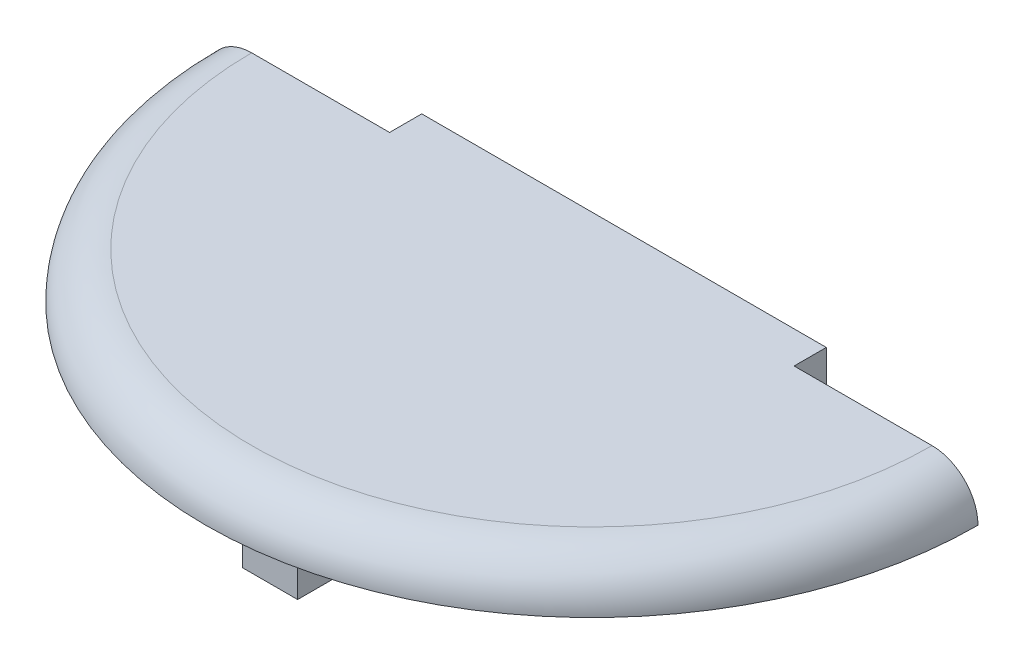
from build123d import *

# Parameters (mm, degrees)
CUT_EXTRUDE1_DEPTH       = 5
CUT_EXTRUDE3_DEPTH       = 45
SKETCH8_R                = 40
CUT_EXTRUDE4_DEPTH       = 32
SKETCH9_R                = 32
SKETCH9_R_2              = 24.5
CUT_EXTRUDE5_DEPTH       = 14
SKETCH10_R               = 26
CUT_EXTRUDE6_DEPTH       = 14
FILLET1_R                = 7
FILLET2_R                = 7
CUT_REVOLVE1_START       = 22
CUT_REVOLVE1_DEPTH       = 30.5
CUT_EXTRUDE12_DEPTH      = 5
SKETCH18_W               = 13
SKETCH18_H               = 8
CUT_EXTRUDE13_DEPTH      = 5
INTERSECT1_OUTLINE_R     = 42
INTERSECT1_DEPTH         = 55
SKETCH20_W               = 6
SKETCH20_H               = 3
BOSS_EXTRUDE1_DEPTH      = 8
BOSS_EXTRUDE2_DEPTH      = 1
BOSS_EXTRUDE2_DEPTH_BACK = 1
SKETCH21_W               = 6
SKETCH21_H               = 6
BOSS_EXTRUDE3_DEPTH      = 7
SKETCH19_R               = 1.5
CUT_EXTRUDE14_DEPTH      = 8
SKETCH23_W               = 20
SKETCH23_H               = 7
CUT_EXTRUDE15_DEPTH      = 7
SKETCH24_W               = 44
SKETCH24_H               = 3.5
CUT_EXTRUDE16_DEPTH      = 5


# Read off the part's stored shape, not the designer's step: Cut-Revolve1, Intersect1
with BuildPart() as part:
    # Sketch1 → Revolve1 (revolve)
    with BuildSketch(Plane.XY, mode=Mode.PRIVATE) as revolve1_sk:
        with BuildLine():
            Line((22.5, 0), (32, 0))
            ThreePointArc((32, 0), (33.414213562, 0.585786438), (34, 2))
            Line((34, 2), (34, 18))
            Line((34, 18), (40, 18))
            ThreePointArc((40, 18), (41.414213562, 18.585786438), (42, 20))
            Line((42, 20), (42, 55))
            ThreePointArc((42, 55), (40.535533906, 58.535533906), (37, 60))
            Line((37, 60), (0, 60))
            Line((0, 60), (0, 18))
            Line((0, 18), (22.5, 18))
            Line((22.5, 18), (22.5, 0))
        make_face()
    revolve(revolve1_sk.sketch.rotate(Axis((0, 2, 0), (0, 1, 0)), 90), axis=Axis((0, 2, 0), (0, 1, 0)))

    # Sketch5 → Cut-Extrude1 (cut)
    with BuildSketch(Plane(origin=(0, 60, 0), x_dir=(1, 0, 0), z_dir=(0, 1, 0))):
        with BuildLine():
            Line((-42, 0), (-40, 0))
            Line((-40, 0), (40, 0))
            Line((40, 0), (42, 0))
            ThreePointArc((42, 0), (0, 42), (-42, 0))
        make_face()
    extrude(amount=-CUT_EXTRUDE1_DEPTH, mode=Mode.SUBTRACT)

    # Sketch7 → Cut-Extrude3 (cut)
    with BuildSketch(Plane.XZ.offset(-18)):
        with BuildLine():
            Line((-21, 0), (21, 0))
            ThreePointArc((21, 0), (0, -21), (-21, 0))
        make_face()
    extrude(amount=-CUT_EXTRUDE3_DEPTH, mode=Mode.SUBTRACT)

    # Sketch8 → Cut-Extrude4 (cut)
    with BuildSketch(Plane(origin=(0, 52.5, 0), x_dir=(1, 0, 0), z_dir=(0, 1, 0))):
        with Locations(Location((0, 0, 0), (0, 0, 270))):
            Circle(SKETCH8_R)
        with BuildLine():
            Line((22.912878475, -2), (-22.912878475, -2))
            ThreePointArc((-22.912878475, -2), (0, 23), (22.912878475, -2))
        make_face(mode=Mode.SUBTRACT)
    extrude(amount=-CUT_EXTRUDE4_DEPTH, mode=Mode.SUBTRACT)

    # Sketch9 → Cut-Extrude5 (cut)
    with BuildSketch(Plane(origin=(0, 2, 0), x_dir=(-1, 0, 0), z_dir=(0, -1, 0))):
        with Locations(Location((0, 0, 0), (0, 0, 90))):
            Circle(SKETCH9_R)
        with Locations(Location((0, 0, 0), (0, 0, 90))):
            Circle(SKETCH9_R_2, mode=Mode.SUBTRACT)
    extrude(amount=-CUT_EXTRUDE5_DEPTH, mode=Mode.SUBTRACT)

    # Sketch10 → Cut-Extrude6 (cut)
    with BuildSketch(Plane(origin=(0, 2, 0), x_dir=(-1, 0, 0), z_dir=(0, -1, 0))):
        Circle(SKETCH10_R)
    extrude(amount=-CUT_EXTRUDE6_DEPTH, mode=Mode.SUBTRACT)

    # Fillet1
    fillet1_edges = [part.edges().sort_by_distance(p)[0] for p in [
        (21, 36.5, 0),
        (-21, 36.5, 0),
    ]]
    fillet(fillet1_edges, radius=FILLET1_R)

    # Fillet2
    fillet2_edges = [part.edges().sort_by_distance(p)[0] for p in [
        (-22.912878475, 36.5, 2),
        (22.912878475, 36.5, 2),
    ]]
    fillet(fillet2_edges, radius=FILLET2_R)

    # Cut-Revolve1 outline → Cut-Revolve1 (cut)
    with BuildSketch(Plane(origin=(0, 0, 0), x_dir=(1, 0, 0), z_dir=(0, 1, 0)).offset(CUT_REVOLVE1_START)):
        with BuildLine():
            Line((-34.641016151, -20), (-36.373066959, -21))
            ThreePointArc((-36.373066959, -21), (0, -42), (36.373066959, -21))
            Line((36.373066959, -21), (34.641016151, -20))
            ThreePointArc((34.641016151, -20), (0, -40), (-34.641016151, -20))
        make_face()
    extrude(amount=CUT_REVOLVE1_DEPTH, mode=Mode.SUBTRACT)

    # Sketch15 → Cut-Extrude12 (cut)
    with BuildSketch(Plane(origin=(0, 20.5, 0), x_dir=(1, 0, 0), z_dir=(0, 1, 0))):
        with BuildLine():
            Line((-28.124355653, -3.514579578), (-26.124355653, -3.514579578))
            ThreePointArc((-26.124355653, -3.514579578), (-24.710142091, -2.928793141), (-24.124355653, -1.514579578))
            Line((-24.124355653, -1.514579578), (-24.124355653, 8.485420422))
            ThreePointArc((-24.124355653, 8.485420422), (-24.710142091, 9.899633984), (-26.124355653, 10.485420422))
            Line((-26.124355653, 10.485420422), (-28.124355653, 10.485420422))
            ThreePointArc((-28.124355653, 10.485420422), (-29.538569215, 9.899633984), (-30.124355653, 8.485420422))
            Line((-30.124355653, 8.485420422), (-30.124355653, -1.514579578))
            ThreePointArc((-30.124355653, -1.514579578), (-29.538569215, -2.928793141), (-28.124355653, -3.514579578))
        make_face()
    extrude(amount=-CUT_EXTRUDE12_DEPTH, mode=Mode.SUBTRACT)

    # Sketch18 → Cut-Extrude13 (cut)
    with BuildSketch(Plane(origin=(0, 55, 0), x_dir=(1, 0, 0), z_dir=(0, 1, 0))):
        with Locations((0.796512215, 32.951769165)):
            Rectangle(SKETCH18_W, SKETCH18_H)
    extrude(amount=-CUT_EXTRUDE13_DEPTH, mode=Mode.SUBTRACT)

    # Intersect1 outline → Intersect1 (cut)
    with BuildSketch(Plane(origin=(0, 0, 0), x_dir=(1, 0, 0), z_dir=(0, 1, 0))):
        Circle(INTERSECT1_OUTLINE_R)
        with BuildLine():
            Line((12.124355653, 0), (-12.124355653, 0))
            ThreePointArc((-12.124355653, 0), (-18.186533479, 3.5), (-18.186533479, 10.5))
            ThreePointArc((-18.186533479, 10.5), (0, 21), (18.186533479, 10.5))
            ThreePointArc((18.186533479, 10.5), (18.186533479, 3.5), (12.124355653, 0))
        make_face(mode=Mode.SUBTRACT)
    extrude(amount=INTERSECT1_DEPTH, mode=Mode.SUBTRACT)

    # Sketch20 → Boss-Extrude1 (add)
    with BuildSketch(Plane.XZ.offset(-55)):
        with Locations((0, 33.5)):
            Rectangle(SKETCH20_W, SKETCH20_H)
    extrude(amount=BOSS_EXTRUDE1_DEPTH)

    # Sketch21 → Boss-Extrude2 (add, two sides: drawn at the far end of the back side and taken through both)
    with BuildSketch(Plane.XZ.offset(-47).offset(-BOSS_EXTRUDE2_DEPTH_BACK)):
        with Locations((0, 32)):
            Rectangle(SKETCH21_W, SKETCH21_H)
    extrude(amount=BOSS_EXTRUDE2_DEPTH + BOSS_EXTRUDE2_DEPTH_BACK)

    # Sketch22 → Boss-Extrude3 (add)
    with BuildSketch(Plane(origin=(0, 0, 0), x_dir=(-1, 0, 0), z_dir=(0, 0, -1))):
        with BuildLine():
            Line((-42, 55), (42, 55))
            ThreePointArc((42, 55), (40.535533906, 58.535533906), (37, 60))
            Line((37, 60), (-37, 60))
            ThreePointArc((-37, 60), (-40.535533906, 58.535533906), (-42, 55))
        make_face()
    extrude(amount=BOSS_EXTRUDE3_DEPTH)

    # Sketch19 → Cut-Extrude14 (cut)
    with BuildSketch(Plane(origin=(0, 0, -7), x_dir=(-1, 0, 0), z_dir=(0, 0, -1))):
        with Locations((0, 57.5)):
            Circle(SKETCH19_R)
        with Locations((-30, 57.5)):
            Circle(SKETCH19_R)
        with Locations((30, 57.5)):
            Circle(SKETCH19_R)
    extrude(amount=-CUT_EXTRUDE14_DEPTH, mode=Mode.SUBTRACT)

    # Sketch23 → Cut-Extrude15 (cut)
    with BuildSketch(Plane(origin=(0, 60, 0), x_dir=(1, 0, 0), z_dir=(0, 1, 0))):
        with Locations((-32, 3.5)):
            Rectangle(SKETCH23_W, SKETCH23_H)
        with Locations((32, 3.5)):
            Rectangle(SKETCH23_W, SKETCH23_H)
    extrude(amount=-CUT_EXTRUDE15_DEPTH, mode=Mode.SUBTRACT)

    # Sketch24 → Cut-Extrude16 (cut)
    with BuildSketch(Plane(origin=(0, 60, 0), x_dir=(1, 0, 0), z_dir=(0, 1, 0))):
        with Locations((0, 5.25)):
            Rectangle(SKETCH24_W, SKETCH24_H)
    extrude(amount=-CUT_EXTRUDE16_DEPTH, mode=Mode.SUBTRACT)


solid = part.part
